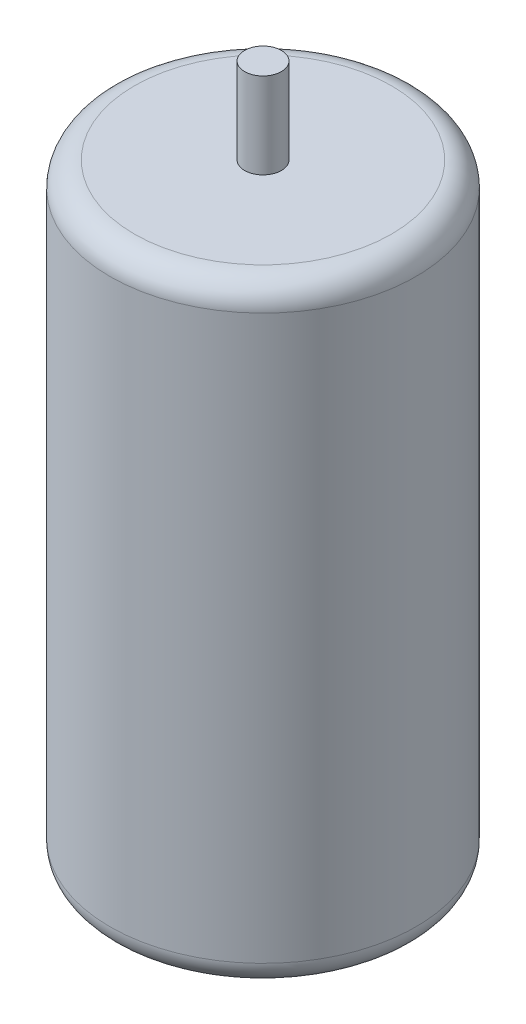
from build123d import *

# Parameters (mm, degrees)
CROQUIS2_R              = 12.5
SALIENTE_EXTRUIR1_DEPTH = 50
REDONDEO1_R             = 2
CROQUIS4_R              = 1.5
SALIENTE_EXTRUIR2_DEPTH = 7
CROQUIS5_W              = 0.93235804
CROQUIS5_H              = 2.963644212
SALIENTE_EXTRUIR3_DEPTH = 4
REDONDEO2_R             = 2
CROQUIS6_R              = 0.814443909
CORTAR_EXTRUIR3_DEPTH   = 18


with BuildPart() as part:
    # Croquis2 → Saliente-Extruir1 (new body)
    with BuildSketch(Plane(origin=(0, 0, 0), x_dir=(1, 0, 0), z_dir=(0, 1, 0))):
        with Locations(Location((0, 0, 0), (0, 0, 270))):
            Circle(CROQUIS2_R)
    extrude(amount=SALIENTE_EXTRUIR1_DEPTH)

    # Redondeo1
    redondeo1_edges = [part.edges().sort_by_distance(p)[0] for p in [
        (0, 0, -12.5),
        (0, 50, -12.5),
    ]]
    fillet(redondeo1_edges, radius=REDONDEO1_R)

    # Croquis4 → Saliente-Extruir2 (add)
    with BuildSketch(Plane(origin=(0, 50, 0), x_dir=(1, 0, 0), z_dir=(0, 1, 0))):
        with Locations(Location((0, 0, 0), (0, 0, 270))):
            Circle(CROQUIS4_R)
    extrude(amount=SALIENTE_EXTRUIR2_DEPTH)

    # Croquis5 → Saliente-Extruir3 (add)
    with BuildSketch(Plane(origin=(0, 0, 0), x_dir=(-1, 0, 0), z_dir=(0, -1, 0))):
        with Locations((-5.00245948, 0)):
            Rectangle(CROQUIS5_W, CROQUIS5_H)
        with Locations((5.00245948, 0)):
            Rectangle(CROQUIS5_W, CROQUIS5_H)
    extrude(amount=SALIENTE_EXTRUIR3_DEPTH)

    # Redondeo2
    # the kernel refuses this fillet: 2 mm, written as the material it takes off along each edge
    with BuildSketch(Plane(origin=(-0.46371954, -4, -1.481822106), x_dir=(0, 1, 0), z_dir=(1, 0, 0)), Plane(origin=(10.4686385, -4, 1.481822106), x_dir=(0, 1, 0), z_dir=(-1, 0, 0))) as redondeo2_piece_1:
        with BuildLine():
            CenterArc((REDONDEO2_R, REDONDEO2_R), REDONDEO2_R, 180, 90)
            Line((0, REDONDEO2_R), (0, 0))
            Line((0, 0), (REDONDEO2_R, 0))
        make_face()
    extrude(amount=10.932358039, mode=Mode.SUBTRACT)
    with BuildSketch(Plane(origin=(-10.4686385, -4, 1.481822106), x_dir=(0, 1, 0), z_dir=(1, 0, 0)), Plane(origin=(0.46371954, -4, -1.481822106), x_dir=(0, 1, 0), z_dir=(-1, 0, 0))) as redondeo2_piece_2:
        with BuildLine():
            CenterArc((REDONDEO2_R, -REDONDEO2_R), REDONDEO2_R, 90, 90)
            Line((0, -REDONDEO2_R), (0, 0))
            Line((0, 0), (REDONDEO2_R, 0))
        make_face()
    extrude(amount=10.932358039, mode=Mode.SUBTRACT)

    # Croquis6 → Cortar-Extruir3 (cut)
    with BuildSketch(Plane(origin=(5.4686385, 0, 0), x_dir=(0, 0, -1), z_dir=(1, 0, 0))):
        with Locations((0, -2)):
            Circle(CROQUIS6_R)
    extrude(amount=-CORTAR_EXTRUIR3_DEPTH, mode=Mode.SUBTRACT)


solid = part.part
